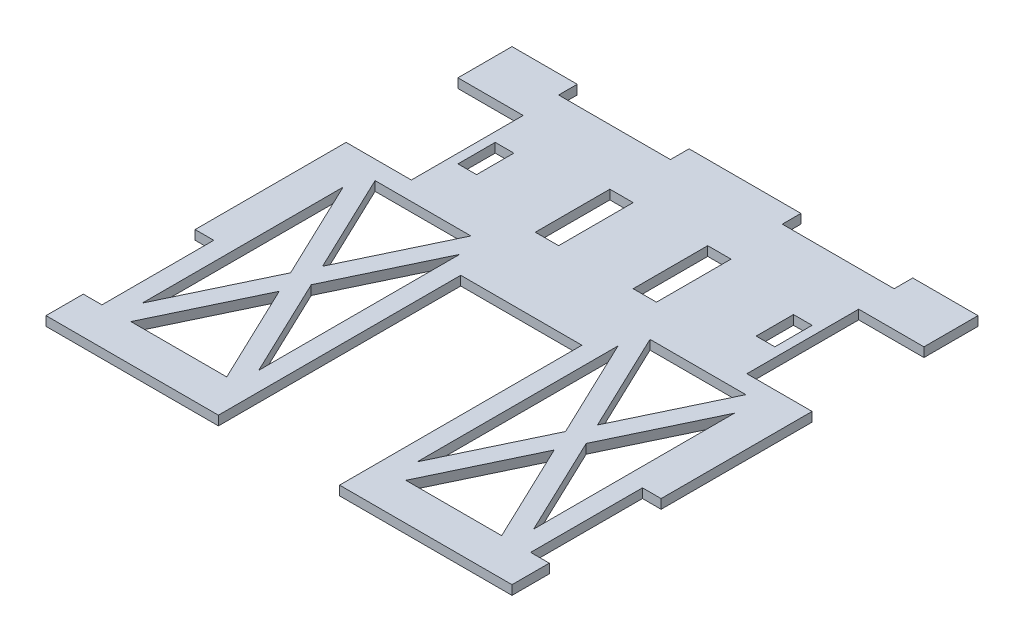
from build123d import *

# Parameters (mm, degrees)
BOSS_EXTRUDE1_DEPTH = 6.35
SKETCH2_W           = 44.45
SKETCH2_H           = 76.2
SKETCH2_W_2         = 12.7
SKETCH2_W_3         = 76.2
SKETCH2_H_2         = 12.7
CUT_EXTRUDE1_DEPTH  = 289.907554418
CUT_EXTRUDE3_DEPTH  = 289.907554418
SKETCH3_W           = 15.875
SKETCH3_H           = 50.8
SKETCH3_W_2         = 12.7
SKETCH3_H_2         = 25.4
CUT_EXTRUDE2_DEPTH  = 289.907554418


with BuildPart() as part:
    # Sketch1 → Boss-Extrude1 (new body)
    with BuildSketch(Plane(origin=(0, 0, 0), x_dir=(1, 0, 0), z_dir=(0, 1, 0))):
        Polygon((-158.75, 76.2), (-158.75, -241.3), (-41.275, -241.3), (-41.275, -76.2), (41.275, -76.2), (41.275, -241.3), (158.75, -241.3), (158.75, 76.2), align=None)
    extrude(amount=BOSS_EXTRUDE1_DEPTH)

    # Sketch2 → Cut-Extrude1 (cut, through all)
    with BuildSketch(Plane(origin=(0, 6.35, 0), x_dir=(1, 0, 0), z_dir=(0, 1, 0))):
        with Locations((136.525, 1.27)):
            Rectangle(SKETCH2_W, SKETCH2_H)
        with Locations((152.4, -177.8)):
            Rectangle(SKETCH2_W_2, SKETCH2_H)
        with Locations((-152.4, -177.8)):
            Rectangle(SKETCH2_W_2, SKETCH2_H)
        with Locations((-136.525, 1.27)):
            Rectangle(SKETCH2_W, SKETCH2_H)
        with Locations((-76.2, 69.85)):
            Rectangle(SKETCH2_W_3, SKETCH2_H_2)
        with Locations((76.2, 69.85)):
            Rectangle(SKETCH2_W_3, SKETCH2_H_2)
    extrude(amount=-CUT_EXTRUDE1_DEPTH, mode=Mode.SUBTRACT)

    # Sketch4 → Cut-Extrude3 (cut, through all)
    with BuildSketch(Plane(origin=(0, 6.35, 0), x_dir=(1, 0, 0), z_dir=(0, 1, 0))):
        Polygon((93.6625, -147.46179464), (61.010684466, -215.9), (126.314315534, -215.9), align=None)
        Polygon((53.975, -64.27679464), (53.975, -201.15320536), (86.626815534, -132.715), align=None)
        Polygon((133.35, -64.27679464), (100.698184466, -132.715), (133.35, -201.15320536), align=None)
        Polygon((61.010684466, -49.53), (93.6625, -117.96820536), (126.314315534, -49.53), align=None)
        Polygon((-86.626815534, -132.715), (-53.975, -201.15320536), (-53.975, -64.27679464), align=None)
        Polygon((-126.314315534, -49.53), (-93.6625, -117.96820536), (-61.010684466, -49.53), align=None)
        Polygon((-61.010684466, -215.9), (-93.6625, -147.46179464), (-126.314315534, -215.9), align=None)
        Polygon((-133.35, -201.15320536), (-100.698184466, -132.715), (-133.35, -64.27679464), align=None)
    extrude(amount=-CUT_EXTRUDE3_DEPTH, mode=Mode.SUBTRACT)

    # Sketch3 → Cut-Extrude2 (cut, through all)
    with BuildSketch(Plane(origin=(0, 6.35, 0), x_dir=(1, 0, 0), z_dir=(0, 1, 0))):
        with Locations((-33.3375, 0)):
            Rectangle(SKETCH3_W, SKETCH3_H)
        with Locations((33.3375, 0)):
            Rectangle(SKETCH3_W, SKETCH3_H)
        with Locations((101.6, 1.27)):
            Rectangle(SKETCH3_W_2, SKETCH3_H_2)
        with Locations((-101.6, 1.27)):
            Rectangle(SKETCH3_W_2, SKETCH3_H_2)
    extrude(amount=-CUT_EXTRUDE2_DEPTH, mode=Mode.SUBTRACT)


solid = part.part
